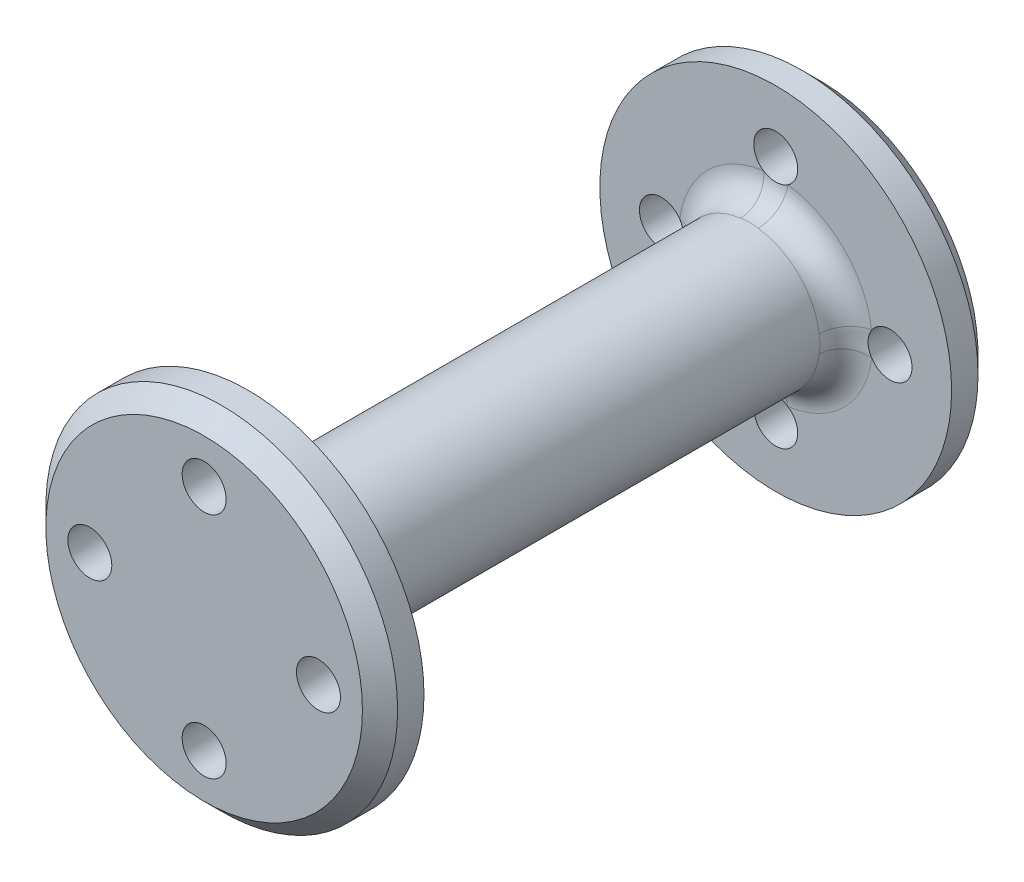
from build123d import *

# Parameters (mm, degrees)
SKETCH1_R                = 8
BOSS_EXTRUDE1_DEPTH      = 30
SKETCH2_R                = 20
BOSS_EXTRUDE2_DEPTH      = 5
CHAMFER1_SIZE            = 2
SKETCH3_R                = 2.5
CUT_EXTRUDE1_DEPTH       = 71.887234394
CIRPATTERN1_COUNT        = 4
FILLET1_R                = 3
MIRROR5_COPY_1_SKETCH_R  = 2.5
MIRROR5_COPY_1_DEPTH     = 71.887234394
MIRROR5_COPY_2_SKETCH_R  = 2.5
MIRROR5_COPY_2_DEPTH     = 71.887234394
MIRROR5_COPY_3_SKETCH_R  = 2.5
MIRROR5_COPY_3_DEPTH     = 71.887234394
CHAMFER1_OF_MIRROR5_SIZE = 2
FILLET1_OF_MIRROR5_R     = 3


with BuildPart() as part:
    # Sketch1 → Boss-Extrude1 (new, symmetric)
    with BuildSketch(Plane.XY):
        Circle(SKETCH1_R)
    extrude(amount=BOSS_EXTRUDE1_DEPTH, both=True)

    # Sketch2 → Boss-Extrude2 (add)
    with BuildSketch(Plane.XY.offset(30)):
        Circle(SKETCH2_R)
    boss_extrude2 = extrude(amount=BOSS_EXTRUDE2_DEPTH)

    # Chamfer1
    chamfer1_edges = [part.edges().sort_by_distance(p)[0] for p in [
        (-20, 0, 35),
    ]]
    chamfer(chamfer1_edges, length=CHAMFER1_SIZE)

    # Sketch3 → Cut-Extrude1 (cut, through all)
    with BuildSketch(Plane.XY.offset(35)):
        with Locations((0, 13)):
            Circle(SKETCH3_R)
    cut_extrude1 = extrude(amount=-CUT_EXTRUDE1_DEPTH, mode=Mode.SUBTRACT)

    # CirPattern1: Cut-Extrude1 ×4 about axis
    cirpattern1_axis = Axis((0, 0, 30), (0, 0, 1))
    for i in range(1, CIRPATTERN1_COUNT):
        add(cut_extrude1.rotate(cirpattern1_axis, i * 360 / CIRPATTERN1_COUNT), mode=Mode.SUBTRACT)

    # Fillet1
    fillet1_edges = [part.edges().sort_by_distance(p)[0] for p in [
        (-8, 0, 30),
    ]]
    fillet(fillet1_edges, radius=FILLET1_R)

    # Mirror5: Boss-Extrude2, Cut-Extrude1 across plane
    add(boss_extrude2.mirror(Plane.XY))
    add(cut_extrude1.mirror(Plane.XY), mode=Mode.SUBTRACT)

    # Mirror5 copy 1 sketch → Mirror5 copy 1 (cut, through all)
    with BuildSketch(Plane.YX.offset(35)):
        with Locations((0, -13)):
            Circle(MIRROR5_COPY_1_SKETCH_R)
    extrude(amount=-MIRROR5_COPY_1_DEPTH, mode=Mode.SUBTRACT)

    # Mirror5 copy 2 sketch → Mirror5 copy 2 (cut, through all)
    with BuildSketch(Plane(origin=(0, 0, -35), x_dir=(-1, 0, 0), z_dir=(0, 0, -1))):
        with Locations((0, -13)):
            Circle(MIRROR5_COPY_2_SKETCH_R)
    extrude(amount=-MIRROR5_COPY_2_DEPTH, mode=Mode.SUBTRACT)

    # Mirror5 copy 3 sketch → Mirror5 copy 3 (cut, through all)
    with BuildSketch(Plane(origin=(0, 0, -35), x_dir=(0, -1, 0), z_dir=(0, 0, -1))):
        with Locations((0, -13)):
            Circle(MIRROR5_COPY_3_SKETCH_R)
    extrude(amount=-MIRROR5_COPY_3_DEPTH, mode=Mode.SUBTRACT)

    # Chamfer1 of Mirror5
    chamfer1_of_mirror5_edges = [part.edges().sort_by_distance(p)[0] for p in [
        (-20, 0, -35),
    ]]
    chamfer(chamfer1_of_mirror5_edges, length=CHAMFER1_OF_MIRROR5_SIZE)

    # Fillet1 of Mirror5
    fillet1_of_mirror5_edges = [part.edges().sort_by_distance(p)[0] for p in [
        (-8, 0, -30),
    ]]
    fillet(fillet1_of_mirror5_edges, radius=FILLET1_OF_MIRROR5_R)


solid = part.part
